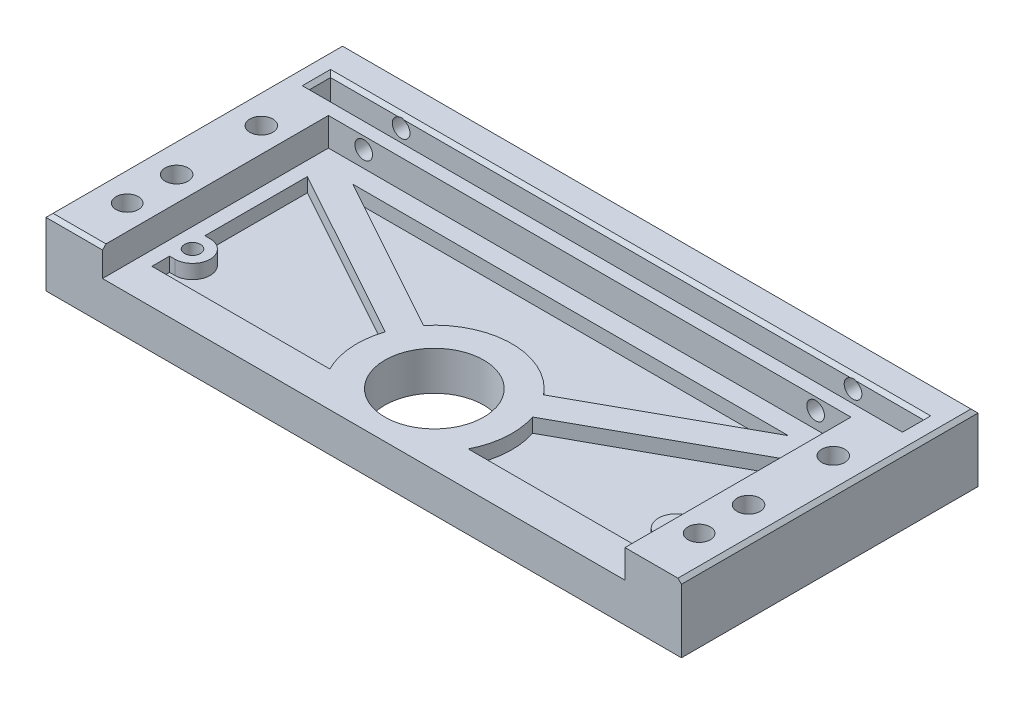
from build123d import *

# Parameters (mm, degrees)
SKETCH1_W               = 90
SKETCH1_H               = 9.525
SKETCH1_R               = 2
BOSS_EXTRUDE1_DEPTH     = 45
SKETCH2_R               = 7
CUT_EXTRUDE2_DEPTH      = 10
SKETCH3_R               = 1.63195
SKETCH3_R_2             = 7
SKETCH3_R_3             = 1.1303
CUT_EXTRUDE3_DEPTH      = 10
SKETCH4_W               = 84
SKETCH4_H               = 3
CUT_EXTRUDE4_DEPTH      = 6
CUT_EXTRUDE6_DEPTH      = 102.072872844
CUT_EXTRUDE6_DEPTH_BACK = 6
SKETCH7_W               = 90
SKETCH7_H               = 3
CUT_EXTRUDE7_DEPTH      = 10
SKETCH9_W               = 74
SKETCH9_H               = 32
CUT_EXTRUDE8_DEPTH      = 4
CUT_EXTRUDE9_REACH      = 97.993
SKETCH10_R              = 1.25
CHAMFER2_SIZE           = 0.5
SKETCH11_R              = 1.5875
CUT_EXTRUDE10_DEPTH     = 4


with BuildPart() as part:
    # Sketch1 → Boss-Extrude1 (new body)
    # profile 1 of 3: a face of its own
    with BuildSketch(Plane.XY):
        with Locations((45, 4.7625)):
            Rectangle(SKETCH1_W, SKETCH1_H)
        with Locations((60, 4.7625)):
            Circle(SKETCH1_R, mode=Mode.SUBTRACT)
        with Locations((30, 4.7625)):
            Circle(SKETCH1_R, mode=Mode.SUBTRACT)
    # profile 2 of 3: a face of its own
    with BuildSketch(Plane.XY):
        with Locations((30, 4.7625)):
            Circle(SKETCH1_R)
    # profile 3 of 3: a face of its own
    with BuildSketch(Plane.XY):
        with Locations((60, 4.7625)):
            Circle(SKETCH1_R)
    extrude(amount=BOSS_EXTRUDE1_DEPTH)

    # Sketch2 → Cut-Extrude2 (cut)
    with BuildSketch(Plane(origin=(0, 9.525, 0), x_dir=(1, 0, 0), z_dir=(0, 1, 0))):
        with Locations(Location((45, -35, 0), (0, 0, 270))):
            Circle(SKETCH2_R)
    extrude(amount=-CUT_EXTRUDE2_DEPTH, mode=Mode.SUBTRACT)

    # Sketch3 → Cut-Extrude3 (cut)
    with BuildSketch(Plane(origin=(0, 9.525, 0), x_dir=(1, 0, 0), z_dir=(0, 1, 0))):
        with Locations(Location((85.5, -31, 0), (0, 0, 270))):
            Circle(SKETCH3_R)
        with Locations(Location((4.5, -31, 0), (0, 0, 270))):
            Circle(SKETCH3_R)
        with Locations(Location((45, -35, 0), (0, 0, 270))):
            Circle(SKETCH3_R_2)
        with Locations(Location((85.5, -19, 0), (0, 0, 270))):
            Circle(SKETCH3_R)
        with Locations(Location((4.5, -19, 0), (0, 0, 270))):
            Circle(SKETCH3_R)
        with Locations(Location((79.25, -35, 0), (0, 0, 270))):
            Circle(SKETCH3_R_3)
        with Locations(Location((10.75, -35, 0), (0, 0, 270))):
            Circle(SKETCH3_R_3)
    extrude(amount=-CUT_EXTRUDE3_DEPTH, mode=Mode.SUBTRACT)

    # Sketch4 → Cut-Extrude4 (cut)
    with BuildSketch(Plane(origin=(0, 9.525, 0), x_dir=(1, 0, 0), z_dir=(0, 1, 0))):
        with Locations((45, -9.2)):
            Rectangle(SKETCH4_W, SKETCH4_H)
    extrude(amount=-CUT_EXTRUDE4_DEPTH, mode=Mode.SUBTRACT)

    # Sketch6 → Cut-Extrude6 (cut, two sides: drawn at the far end of the back side and taken through both)
    with BuildSketch(Plane(origin=(0, 9.525, 0), x_dir=(1, 0, 0), z_dir=(0, 1, 0)).offset(-CUT_EXTRUDE6_DEPTH_BACK)):
        with BuildLine():
            ThreePointArc((10.75, -32.5), (13.25, -35), (10.75, -37.5))
            Line((10.75, -37.5), (10, -37.5))
            Line((10, -37.5), (10, -40))
            Line((10, -40), (35.202041029, -40))
            ThreePointArc((35.202041029, -40), (34.031236019, -35.828381989), (34.562237569, -31.528240298))
            Line((34.562237569, -31.528240298), (10, -17.983920725))
            Line((10, -17.983920725), (10, -32.5))
            Line((10, -32.5), (10.75, -32.5))
        make_face()
        with BuildLine():
            Line((14.141825149, -15.7), (36.493753196, -28.025491752))
            ThreePointArc((36.493753196, -28.025491752), (45, -24), (53.506246804, -28.025491752))
            Line((53.506246804, -28.025491752), (75.858174851, -15.7))
            Line((75.858174851, -15.7), (14.141825149, -15.7))
        make_face()
        with BuildLine():
            ThreePointArc((55.437762431, -31.528240298), (55.968763981, -35.828381989), (54.797958971, -40))
            Line((54.797958971, -40), (80, -40))
            Line((80, -40), (80, -37.5))
            Line((80, -37.5), (79.25, -37.5))
            ThreePointArc((79.25, -37.5), (76.75, -35), (79.25, -32.5))
            Line((79.25, -32.5), (80, -32.5))
            Line((80, -32.5), (80, -17.983920725))
            Line((80, -17.983920725), (55.437762431, -31.528240298))
        make_face()
    extrude(amount=CUT_EXTRUDE6_DEPTH + CUT_EXTRUDE6_DEPTH_BACK, mode=Mode.SUBTRACT)

    # Sketch7 → Cut-Extrude7 (cut)
    with BuildSketch(Plane(origin=(0, 9.525, 0), x_dir=(1, 0, 0), z_dir=(0, 1, 0))):
        with Locations((45, -1.5)):
            Rectangle(SKETCH7_W, SKETCH7_H)
    extrude(amount=-CUT_EXTRUDE7_DEPTH, mode=Mode.SUBTRACT)

    # Sketch9 → Cut-Extrude8 (cut)
    with BuildSketch(Plane(origin=(0, 9.525, 0), x_dir=(1, 0, 0), z_dir=(0, 1, 0))):
        with Locations((45, -29)):
            Rectangle(SKETCH9_W, SKETCH9_H)
    extrude(amount=-CUT_EXTRUDE8_DEPTH, mode=Mode.SUBTRACT)

    # Cut-Extrude9: up to this face of the body (flat: up to its plane)
    cut_extrude9_end = Plane(part.part.faces().sort_by_distance((45, 4.7625, 3))[0])
    # Sketch10 → Cut-Extrude9 (cut, up to the picked face)
    with BuildSketch(Plane.XY.offset(13), mode=Mode.PRIVATE) as cut_extrude9_sk1:
        with Locations((77, 7.825)):
            Circle(SKETCH10_R)
    cut_extrude9_tool1 = split(extrude(cut_extrude9_sk1.sketch, amount=-CUT_EXTRUDE9_REACH, mode=Mode.PRIVATE), bisect_by=cut_extrude9_end, keep=Keep.BOTH, mode=Mode.PRIVATE)
    # Sketch10 → Cut-Extrude9 (cut, up to the picked face)
    with BuildSketch(Plane.XY.offset(13), mode=Mode.PRIVATE) as cut_extrude9_sk2:
        with Locations((13, 7.825)):
            Circle(SKETCH10_R)
    cut_extrude9_tool2 = split(extrude(cut_extrude9_sk2.sketch, amount=-CUT_EXTRUDE9_REACH, mode=Mode.PRIVATE), bisect_by=cut_extrude9_end, keep=Keep.BOTH, mode=Mode.PRIVATE)
    add(cut_extrude9_tool1.solids().sort_by(Axis((77, 7.825, 13), (0, 0, -1)))[0], mode=Mode.SUBTRACT)
    add(cut_extrude9_tool2.solids().sort_by(Axis((13, 7.825, 13), (0, 0, -1)))[0], mode=Mode.SUBTRACT)

    # Chamfer2
    # the kernel refuses this chamfer: 0.5 mm, written as the material it takes off along each edge
    with BuildSketch(Plane(origin=(9.285841494, 9.525, 45), x_dir=(0, -0.999621916911297, 0.0274958766105822), z_dir=(-1, 0, 0))) as chamfer2_piece_1:
        Polygon((CHAMFER2_SIZE * 0.999621916911, -CHAMFER2_SIZE * 0.0274958766106), (-CHAMFER2_SIZE * 0.0274958766106, -CHAMFER2_SIZE * 0.999621916911), (0, 0), align=None)
    extrude(amount=10.571682988, mode=Mode.SUBTRACT)
    with BuildSketch(Plane(origin=(-1.285841494, 9.525, 3), x_dir=(0, -0.9996219169112968, -0.02749587661058651), z_dir=(1, 0, 0))) as chamfer2_piece_2:
        Polygon((CHAMFER2_SIZE * 0.999621916911, -CHAMFER2_SIZE * 0.0274958766106), (-CHAMFER2_SIZE * 0.0274958766106, -CHAMFER2_SIZE * 0.999621916911), (0, 0), align=None)
    extrude(amount=92.571682988, mode=Mode.SUBTRACT)
    with BuildSketch(Plane(origin=(87, 9.525, 10.7), x_dir=(0.999621916911297, 0.027495876610582292, 0), z_dir=(0, 0, -1)), Plane(origin=(3, 9.525, 7.7), x_dir=(-0.9996219169112968, 0.027495876610585408, -1.1837901526131803e-15), z_dir=(0, 0, 1))) as chamfer2_piece_3:
        Polygon((CHAMFER2_SIZE * 0.999621916911, CHAMFER2_SIZE * 0.0274958766106), (-CHAMFER2_SIZE * 0.0274958766106, CHAMFER2_SIZE * 0.999621916911), (0, 0), align=None)
    extrude(amount=3, mode=Mode.SUBTRACT)
    with BuildSketch(Plane(origin=(87, 9.525, 7.7), x_dir=(0, 0.0274958766105822, -0.999621916911297), z_dir=(-1, 0, 0)), Plane(origin=(3, 9.525, 10.7), x_dir=(0, 0.027495876610585647, 0.9996219169112968), z_dir=(1, 0, 0))) as chamfer2_piece_4:
        Polygon((CHAMFER2_SIZE * 0.999621916911, CHAMFER2_SIZE * 0.0274958766106), (-CHAMFER2_SIZE * 0.0274958766106, CHAMFER2_SIZE * 0.999621916911), (0, 0), align=None)
    extrude(amount=84, mode=Mode.SUBTRACT)
    with BuildSketch(Plane(origin=(0, 9.525, 1.714158506), x_dir=(-0.02749587661058639, -0.9996219169112968, 0), z_dir=(0, 0, 1))) as chamfer2_piece_5:
        Polygon((CHAMFER2_SIZE * 0.999621916911, CHAMFER2_SIZE * 0.0274958766106), (-CHAMFER2_SIZE * 0.0274958766106, CHAMFER2_SIZE * 0.999621916911), (0, 0), align=None)
    extrude(amount=44.571682988, mode=Mode.SUBTRACT)
    with BuildSketch(Plane(origin=(90, 9.525, 1.714158506), x_dir=(0.0274958766105822, -0.999621916911297, 0), z_dir=(0, 0, 1))) as chamfer2_piece_6:
        Polygon((CHAMFER2_SIZE * 0.999621916911, -CHAMFER2_SIZE * 0.0274958766106), (-CHAMFER2_SIZE * 0.0274958766106, -CHAMFER2_SIZE * 0.999621916911), (0, 0), align=None)
    extrude(amount=44.571682988, mode=Mode.SUBTRACT)
    with BuildSketch(Plane(origin=(87, 9.525, 11.985841494), x_dir=(0.9996219169112968, 0.02749587661058574, 0), z_dir=(0, 0, -1))) as chamfer2_piece_7a_section:
        Polygon((CHAMFER2_SIZE * 0.999621916911, CHAMFER2_SIZE * 0.0274958766106), (-CHAMFER2_SIZE * 0.0274958766106, CHAMFER2_SIZE * 0.999621916911), (0, 0), align=None)
    chamfer2_piece_7a = extrude(amount=4.285841494, mode=Mode.PRIVATE)
    chamfer2_piece_7a = split(chamfer2_piece_7a, bisect_by=Plane(origin=(87.164896813, 9.360103187, 10.7), z_dir=(0, 0, 1)), keep=Keep.TOP, mode=Mode.PRIVATE)
    with BuildSketch(Plane(origin=(3, 9.525, 10.7), x_dir=(0, 0.027495876610585647, 0.9996219169112968), z_dir=(1, 0, 0))) as chamfer2_piece_7b_section:
        Polygon((CHAMFER2_SIZE * 0.999621916911, CHAMFER2_SIZE * 0.0274958766106), (-CHAMFER2_SIZE * 0.0274958766106, CHAMFER2_SIZE * 0.999621916911), (0, 0), align=None)
    chamfer2_piece_7b = extrude(amount=85.285841494, mode=Mode.PRIVATE)
    chamfer2_piece_7b = split(chamfer2_piece_7b, bisect_by=Plane(origin=(87, 9.360103187, 10.864896813), z_dir=(1, 0, 0)), keep=Keep.TOP, mode=Mode.PRIVATE)
    chamfer2_piece_7 = chamfer2_piece_7a & chamfer2_piece_7b
    add(chamfer2_piece_7, mode=Mode.SUBTRACT)
    with BuildSketch(Plane(origin=(87, 9.525, 10.7), x_dir=(0.999621916911297, 0.027495876610582292, 0), z_dir=(0, 0, -1))) as chamfer2_piece_8a_section:
        Polygon((CHAMFER2_SIZE * 0.999621916911, CHAMFER2_SIZE * 0.0274958766106), (-CHAMFER2_SIZE * 0.0274958766106, CHAMFER2_SIZE * 0.999621916911), (0, 0), align=None)
    chamfer2_piece_8a = extrude(amount=4.285841494, mode=Mode.PRIVATE)
    chamfer2_piece_8a = split(chamfer2_piece_8a, bisect_by=Plane(origin=(87.164896813, 9.360103187, 7.7), z_dir=(0, 0, -1)), keep=Keep.TOP, mode=Mode.PRIVATE)
    with BuildSketch(Plane(origin=(88.285841494, 9.525, 7.7), x_dir=(0, 0.027495876610585647, -0.9996219169112968), z_dir=(-1, 0, 0))) as chamfer2_piece_8b_section:
        Polygon((CHAMFER2_SIZE * 0.999621916911, CHAMFER2_SIZE * 0.0274958766106), (-CHAMFER2_SIZE * 0.0274958766106, CHAMFER2_SIZE * 0.999621916911), (0, 0), align=None)
    chamfer2_piece_8b = extrude(amount=85.285841494, mode=Mode.PRIVATE)
    chamfer2_piece_8b = split(chamfer2_piece_8b, bisect_by=Plane(origin=(87, 9.360103187, 7.535103187), z_dir=(1, 0, 0)), keep=Keep.TOP, mode=Mode.PRIVATE)
    chamfer2_piece_8 = chamfer2_piece_8a & chamfer2_piece_8b
    add(chamfer2_piece_8, mode=Mode.SUBTRACT)
    with BuildSketch(Plane(origin=(87, 9.525, 7.7), x_dir=(0, 0.0274958766105822, -0.999621916911297), z_dir=(-1, 0, 0))) as chamfer2_piece_9a_section:
        Polygon((CHAMFER2_SIZE * 0.999621916911, CHAMFER2_SIZE * 0.0274958766106), (-CHAMFER2_SIZE * 0.0274958766106, CHAMFER2_SIZE * 0.999621916911), (0, 0), align=None)
    chamfer2_piece_9a = extrude(amount=85.285841494, mode=Mode.PRIVATE)
    chamfer2_piece_9a = split(chamfer2_piece_9a, bisect_by=Plane(origin=(3, 9.360103187, 7.535103187), z_dir=(-1, 0, 0)), keep=Keep.TOP, mode=Mode.PRIVATE)
    with BuildSketch(Plane(origin=(3, 9.525, 6.414158506), x_dir=(-0.9996219169112968, 0.027495876610585623, -1.1837901526131803e-15), z_dir=(0, 0, 1))) as chamfer2_piece_9b_section:
        Polygon((CHAMFER2_SIZE * 0.999621916911, CHAMFER2_SIZE * 0.0274958766106), (-CHAMFER2_SIZE * 0.0274958766106, CHAMFER2_SIZE * 0.999621916911), (0, 0), align=None)
    chamfer2_piece_9b = extrude(amount=4.285841494, mode=Mode.PRIVATE)
    chamfer2_piece_9b = split(chamfer2_piece_9b, bisect_by=Plane(origin=(2.835103187, 9.360103187, 7.7), z_dir=(0, 0, -1)), keep=Keep.TOP, mode=Mode.PRIVATE)
    chamfer2_piece_9 = chamfer2_piece_9a & chamfer2_piece_9b
    add(chamfer2_piece_9, mode=Mode.SUBTRACT)
    with BuildSketch(Plane(origin=(1.714158506, 9.525, 10.7), x_dir=(0, 0.027495876610585647, 0.9996219169112968), z_dir=(1, 0, 0))) as chamfer2_piece_10a_section:
        Polygon((CHAMFER2_SIZE * 0.999621916911, CHAMFER2_SIZE * 0.0274958766106), (-CHAMFER2_SIZE * 0.0274958766106, CHAMFER2_SIZE * 0.999621916911), (0, 0), align=None)
    chamfer2_piece_10a = extrude(amount=85.285841494, mode=Mode.PRIVATE)
    chamfer2_piece_10a = split(chamfer2_piece_10a, bisect_by=Plane(origin=(3, 9.360103187, 10.864896813), z_dir=(-1, 0, 0)), keep=Keep.TOP, mode=Mode.PRIVATE)
    with BuildSketch(Plane(origin=(3, 9.525, 7.7), x_dir=(-0.9996219169112968, 0.027495876610585408, -1.1837901526131803e-15), z_dir=(0, 0, 1))) as chamfer2_piece_10b_section:
        Polygon((CHAMFER2_SIZE * 0.999621916911, CHAMFER2_SIZE * 0.0274958766106), (-CHAMFER2_SIZE * 0.0274958766106, CHAMFER2_SIZE * 0.999621916911), (0, 0), align=None)
    chamfer2_piece_10b = extrude(amount=4.285841494, mode=Mode.PRIVATE)
    chamfer2_piece_10b = split(chamfer2_piece_10b, bisect_by=Plane(origin=(2.835103187, 9.360103187, 10.7), z_dir=(0, 0, 1)), keep=Keep.TOP, mode=Mode.PRIVATE)
    chamfer2_piece_10 = chamfer2_piece_10a & chamfer2_piece_10b
    add(chamfer2_piece_10, mode=Mode.SUBTRACT)

    # Sketch11 → Cut-Extrude10 (cut)
    with BuildSketch(Plane(origin=(0, 9.525, 0), x_dir=(1, 0, 0), z_dir=(0, 1, 0))):
        with Locations(Location((85.5, -38, 0), (0, 0, 180))):
            Circle(SKETCH11_R)
        with Locations(Location((4.5, -38, 0), (0, 0, 180))):
            Circle(SKETCH11_R)
    extrude(amount=-CUT_EXTRUDE10_DEPTH, mode=Mode.SUBTRACT)


solid = part.part
